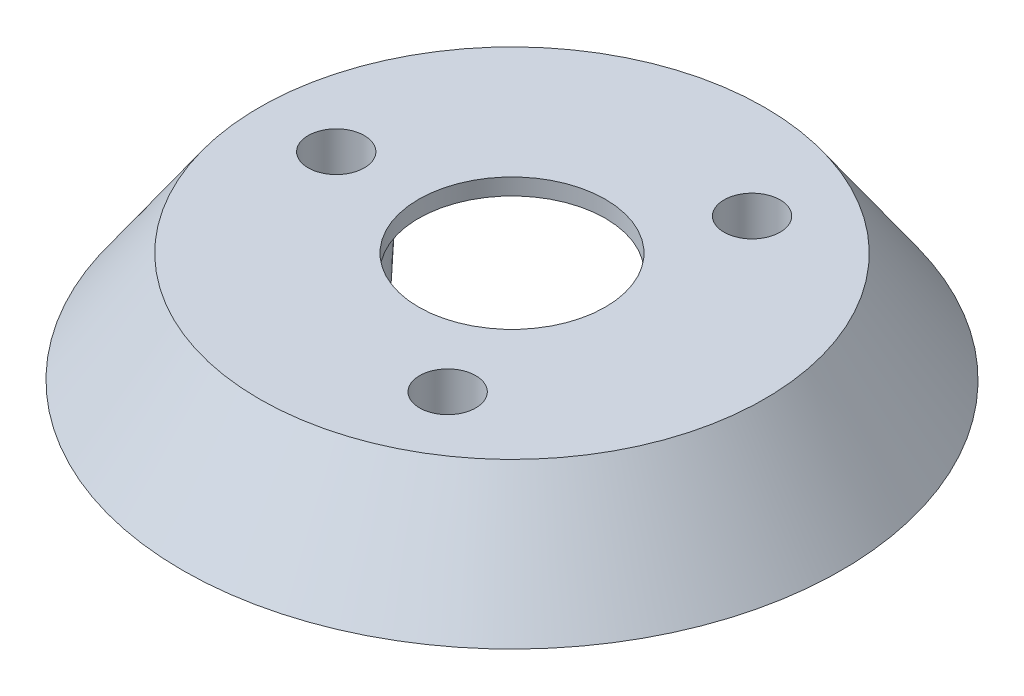
from build123d import *

# Parameters (mm, degrees)
ESQUISSE1_R                                 = 30
BOSS_EXTRU_1_DEPTH                          = 10
CHANFREIN1_SIZE                             = 10
CHANFREIN1_SIZE_2                           = 7.002075382
COQUE2_T                                    = -1.5
ESQUISSE2_R                                 = 4.000000000000001
BOSS_EXTRU_2_DEPTH                          = 8.5
CHANFREIN2_SIZE                             = 8.5
CHANFREIN2_SIZE_2                           = 0.445466124
ESQUISSE5_R                                 = 2.5545338760941463
ENL_V_MAT_EXTRU_1_DEPTH                     = 10
R_P_TITION_CIRCULAIRE1_COUNT                = 3
CHANFREIN2_OF_R_P_TITION_CIRCULAIRE1_SIZE   = 0.445466124
CHANFREIN2_OF_R_P_TITION_CIRCULAIRE1_SIZE_2 = 8.5
ESQUISSE6_R                                 = 8.5
ENL_V_MAT_EXTRU_2_DEPTH                     = 8.5


with BuildPart() as part:
    # Esquisse1 → Boss.-Extru.1 (new body)
    with BuildSketch(Plane(origin=(0, 0, 0), x_dir=(1, 0, 0), z_dir=(0, 1, 0))):
        with Locations(Location((0, 0, 0), (0, 0, 270))):
            Circle(ESQUISSE1_R)
    extrude(amount=BOSS_EXTRU_1_DEPTH)

    # Chanfrein1
    # the kernel refuses this chamfer: 10, 7.002075382 mm, written as the material it takes off along each edge
    with BuildSketch(Plane(origin=(0, 10, 0), x_dir=(-1.8e-16, 0, 1), z_dir=(-1, 0, -1.8e-16))) as chanfrein1_piece_1:
        Polygon((30, -CHANFREIN1_SIZE), (30 - CHANFREIN1_SIZE_2, 0), (30, 0), align=None)
    revolve(axis=Axis((0, 10, 0), (0, 1, 0)), mode=Mode.SUBTRACT)

    # Coque2
    coque2_openings = [part.faces().sort_by_distance(p)[0] for p in [
        (0, 0, 0),
    ]]
    offset(amount=COQUE2_T, openings=coque2_openings, kind=Kind.INTERSECTION)

    # Esquisse2 → Boss.-Extru.2 (add)
    with BuildSketch(Plane.XZ.offset(-8.5)):
        with Locations(Location((-16, 0, 0), (0, 0, 90))):
            Circle(ESQUISSE2_R)
    boss_extru_2 = extrude(amount=BOSS_EXTRU_2_DEPTH)

    # Chanfrein2
    # the kernel refuses this chamfer: 8.5, 0.445466124 mm, written as the material it takes off along each edge
    with BuildSketch(Plane(origin=(-16, 0, 0), x_dir=(0, 0, 1), z_dir=(1, 0, 0))) as chanfrein2_piece_1_section:
        Polygon((4.000000000000001, -CHANFREIN2_SIZE), (4.000000000000001 - CHANFREIN2_SIZE_2, 0), (4.000000000000001, 0), align=None)
    chanfrein2_piece_1 = revolve(axis=Axis((-16, 0, 0), (0, -1, 0)), mode=Mode.PRIVATE)
    chanfrein2_piece_1 = split(chanfrein2_piece_1, bisect_by=Plane(origin=(-16, 8.5, -3.8124488578332274), z_dir=(0, -1, 0)), keep=Keep.TOP, mode=Mode.PRIVATE)
    add(chanfrein2_piece_1, mode=Mode.SUBTRACT)

    # Esquisse5 → Enlèv. mat.-Extru.1 (cut)
    with BuildSketch(Plane.XZ):
        with Locations(Location((-16, 0, 0), (0, 0, 270))):
            Circle(ESQUISSE5_R)
    enl_v_mat_extru_1 = extrude(amount=-ENL_V_MAT_EXTRU_1_DEPTH, mode=Mode.SUBTRACT)

    # Répétition circulaire1: Boss.-Extru.2, Enlèv. mat.-Extru.1 ×3 about axis
    r_p_tition_circulaire1_axis = Axis((9.3e-16, 0, 6.2e-16), (0, 1, 0))
    add([boss_extru_2.rotate(r_p_tition_circulaire1_axis, i * 360 / R_P_TITION_CIRCULAIRE1_COUNT) for i in range(1, R_P_TITION_CIRCULAIRE1_COUNT)])
    add([enl_v_mat_extru_1.rotate(r_p_tition_circulaire1_axis, i * 360 / R_P_TITION_CIRCULAIRE1_COUNT) for i in range(1, R_P_TITION_CIRCULAIRE1_COUNT)], mode=Mode.SUBTRACT)

    # Chanfrein2 of Répétition circulaire1
    # the kernel refuses this chamfer: 8.5, 0.445466124 mm, written as the material it takes off along each edge
    with BuildSketch(Plane(origin=(7.999999999999997, 0, 13.856406460551021), x_dir=(0.8660254037844387, 0, -0.5000000000000001), z_dir=(-0.5000000000000001, 0, -0.8660254037844387))) as chanfrein2_of_r_p_tition_circulaire1_piece_1_section:
        Polygon((4 - CHANFREIN2_OF_R_P_TITION_CIRCULAIRE1_SIZE, 0), (4.000000000000002, -CHANFREIN2_OF_R_P_TITION_CIRCULAIRE1_SIZE_2), (4, 0), align=None)
    chanfrein2_of_r_p_tition_circulaire1_piece_1 = revolve(axis=Axis((7.999999999999997, 0, 13.856406460551021), (0, -1, 0)), mode=Mode.PRIVATE)
    chanfrein2_of_r_p_tition_circulaire1_piece_1 = split(chanfrein2_of_r_p_tition_circulaire1_piece_1, bisect_by=Plane(origin=(4.6983224384874545, 8.5, 15.762630889467637), z_dir=(0, -1, 0)), keep=Keep.TOP, mode=Mode.PRIVATE)
    add(chanfrein2_of_r_p_tition_circulaire1_piece_1, mode=Mode.SUBTRACT)
    with BuildSketch(Plane(origin=(8.000000000000009, 0, -13.856406460551014), x_dir=(-0.8660254037844384, 0, -0.5000000000000003), z_dir=(-0.5000000000000003, 0, 0.8660254037844384))) as chanfrein2_of_r_p_tition_circulaire1_piece_2_section:
        Polygon((4 - CHANFREIN2_OF_R_P_TITION_CIRCULAIRE1_SIZE, 0), (4, -CHANFREIN2_OF_R_P_TITION_CIRCULAIRE1_SIZE_2), (4, 0), align=None)
    chanfrein2_of_r_p_tition_circulaire1_piece_2 = revolve(axis=Axis((8.000000000000009, 0, -13.856406460551014), (0, -1, 0)), mode=Mode.PRIVATE)
    chanfrein2_of_r_p_tition_circulaire1_piece_2 = split(chanfrein2_of_r_p_tition_circulaire1_piece_2, bisect_by=Plane(origin=(11.301677561512552, 8.5, -11.950182031634398), z_dir=(0, -1, 0)), keep=Keep.TOP, mode=Mode.PRIVATE)
    add(chanfrein2_of_r_p_tition_circulaire1_piece_2, mode=Mode.SUBTRACT)

    # Esquisse6 → Enlèv. mat.-Extru.2 (cut)
    with BuildSketch(Plane.XZ.offset(-8.5)):
        with Locations(Location((0, 0, 0), (0, 0, 270))):
            Circle(ESQUISSE6_R)
    extrude(amount=-ENL_V_MAT_EXTRU_2_DEPTH, mode=Mode.SUBTRACT)


solid = part.part
